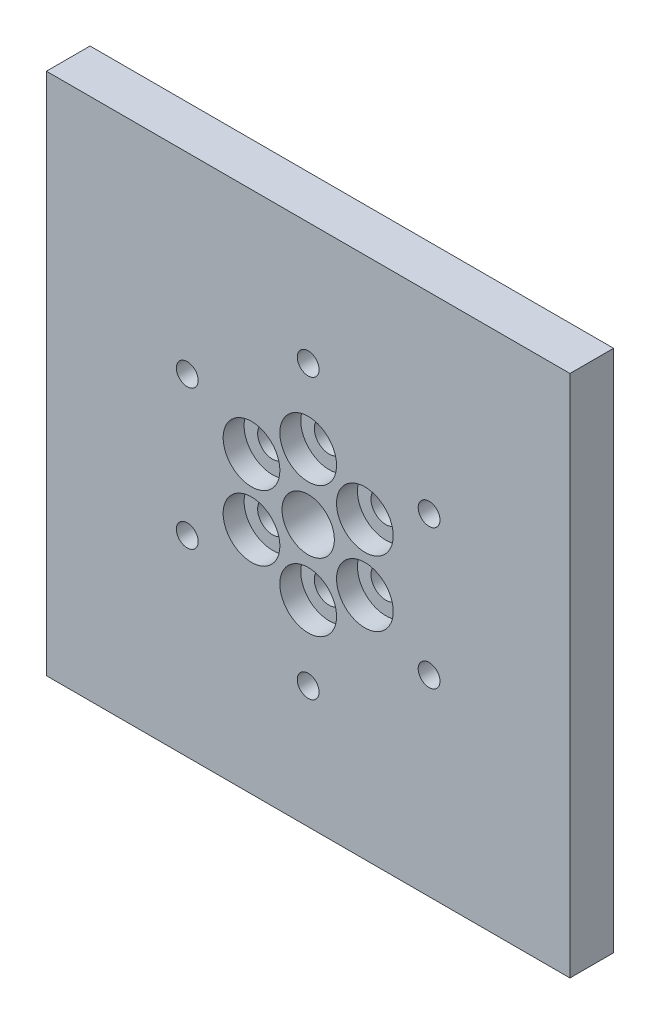
from build123d import *

# Parameters (mm, degrees)
SKETCH1_W                                            = 60
SKETCH1_H                                            = 60
BOSS_EXTRUDE1_DEPTH                                  = 5
F_6_0MM_DOWEL_HOLE1_D                                = 6
CBORE_FOR_M3_HEX_SOCKET_THIN_HEAD_CAP_SC_D           = 3.4
CBORE_FOR_M3_HEX_SOCKET_THIN_HEAD_CAP_SC_CBORE_D     = 6.5
CBORE_FOR_M3_HEX_SOCKET_THIN_HEAD_CAP_SC_CBORE_DEPTH = 2.4
TAP_DRILL_FOR_M3_TAP1_D                              = 2.5


with BuildPart() as part:
    # Sketch1 → Boss-Extrude1 (new body)
    with BuildSketch(Plane.XY):
        with Locations((30, 30)):
            Rectangle(SKETCH1_W, SKETCH1_H)
    extrude(amount=BOSS_EXTRUDE1_DEPTH)

    # Ø6.0mm Dowel Hole1 (through all)
    with Locations(Plane.XY.offset(5)):
        with Locations((30, 30)):
            Hole(F_6_0MM_DOWEL_HOLE1_D / 2)

    # CBORE for M3 Hex Socket Thin Head Cap Screw4 (through all)
    with Locations(Plane.XY.offset(5)):
        with Locations((23.504809472, 33.75), (30, 37.5), (36.495190528, 33.75), (36.495190528, 26.25), (30, 22.5), (23.504809472, 26.25)):
            CounterBoreHole(CBORE_FOR_M3_HEX_SOCKET_THIN_HEAD_CAP_SC_D / 2, CBORE_FOR_M3_HEX_SOCKET_THIN_HEAD_CAP_SC_CBORE_D / 2, CBORE_FOR_M3_HEX_SOCKET_THIN_HEAD_CAP_SC_CBORE_DEPTH)

    # Tap Drill for M3 Tap1 (through all)
    with Locations(Plane.XY.offset(5)):
        with Locations((16.143593539, 38), (30, 46), (43.856406461, 38), (43.856406461, 22), (30, 14), (16.143593539, 22)):
            Hole(TAP_DRILL_FOR_M3_TAP1_D / 2)


solid = part.part
